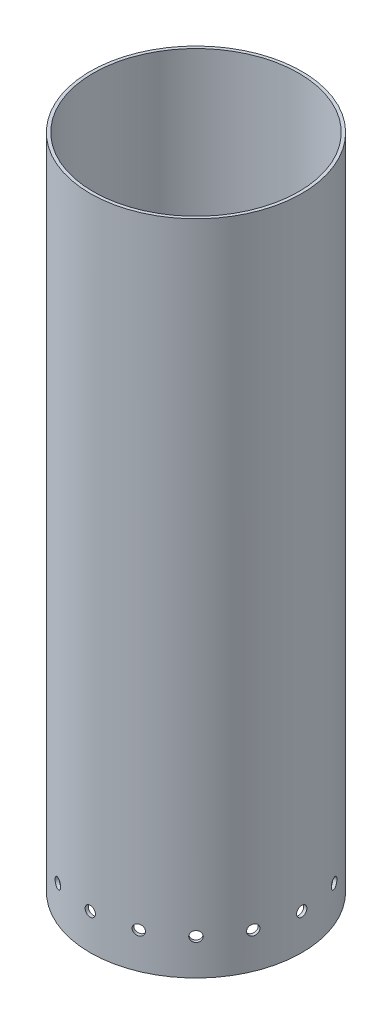
from build123d import *

# Parameters (mm, degrees)
SKETCH1_R           = 65.405
SKETCH1_R_2         = 63.5
BOSS_EXTRUDE1_DEPTH = 406.4
CUT_EXTRUDE3_REACH  = 433.914
SKETCH4_R           = 3.175
CIRPATTERN2_COUNT   = 16


with BuildPart() as part:
    # Sketch1 → Boss-Extrude1 (new body)
    with BuildSketch(Plane(origin=(0, 0, 0), x_dir=(1, 0, 0), z_dir=(0, 1, 0))):
        Circle(SKETCH1_R)
        Circle(SKETCH1_R_2, mode=Mode.SUBTRACT)
    extrude(amount=-BOSS_EXTRUDE1_DEPTH)

    # Sketch4 → Cut-Extrude3 (cut, up to next)
    with BuildSketch(Plane.XY.offset(65.405), mode=Mode.PRIVATE) as cut_extrude3_sk1:
        with Locations((0, -384.175)):
            Circle(SKETCH4_R)
    cut_extrude3_tool1 = extrude(cut_extrude3_sk1.sketch, amount=-CUT_EXTRUDE3_REACH, mode=Mode.PRIVATE) & part.part
    cut_extrude3 = cut_extrude3_tool1.solids().sort_by_distance((0, -384.175, 65.405))[0]
    add(cut_extrude3, mode=Mode.SUBTRACT)

    # CirPattern2: Cut-Extrude3 ×16 about axis
    cirpattern2_axis = Axis((0, -406.4, 0), (0, 1, 0))
    for i in range(1, CIRPATTERN2_COUNT):
        add(cut_extrude3.rotate(cirpattern2_axis, i * 360 / CIRPATTERN2_COUNT), mode=Mode.SUBTRACT)


solid = part.part
